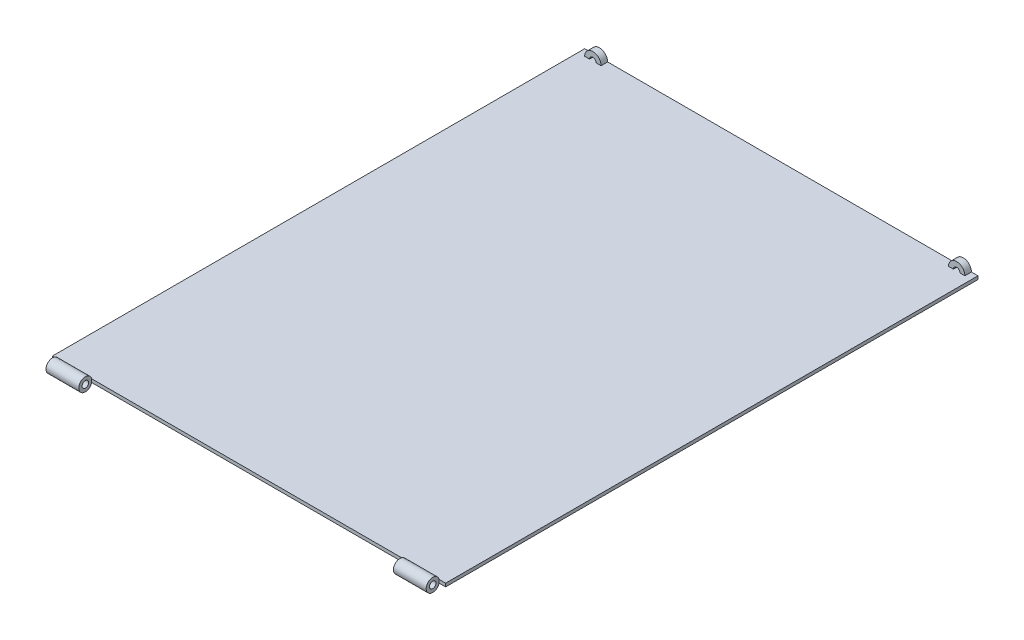
from build123d import *
from build123d.topology import SkipClean

# Parameters (mm, degrees)
SKETCH1_W                       = 60
SKETCH1_H                       = 82.18
BOSS_EXTRUDE1_DEPTH             = 0.5
BOSS_EXTRUDE2_REACH             = 52.879
SKETCH3_R                       = 1
SKETCH3_R_2                     = 0.5
BOSS_EXTRUDE2_DIRECTION_2_REACH = 52.879
SKETCH4_R                       = 0.5
CUT_EXTRUDE1_DEPTH              = 74.301641182
CUT_EXTRUDE2_DEPTH              = 52.702326834
CUT_EXTRUDE2_DEPTH_BACK         = 52.702326834
SKETCH5_W                       = 48
SKETCH5_H                       = 1.968245837
SKETCH5_W_2                     = 1
BOSS_EXTRUDE3_DEPTH             = 1


with BuildPart() as part:
    # Sketch1 → Boss-Extrude1 (new body)
    with BuildSketch(Plane(origin=(0, 0, 0), x_dir=(1, 0, 0), z_dir=(0, 1, 0))):
        Rectangle(SKETCH1_W, SKETCH1_H)
    extrude(amount=BOSS_EXTRUDE1_DEPTH)

    # Boss-Extrude2: up to this face of the body (flat: up to its plane)
    boss_extrude2_end = Plane(part.part.faces().sort_by_distance((30, 0.25, 0))[0])
    # Sketch3 → Boss-Extrude2 (add, up to the picked face)
    with BuildSketch(Plane(origin=(0, 0, 0), x_dir=(0, 0, -1), z_dir=(1, 0, 0)), mode=Mode.PRIVATE) as boss_extrude2_sk1:
        with Locations((-41.09, 0.25)):
            Circle(SKETCH3_R)
        with Locations((-41.09, 0.25)):
            Circle(SKETCH3_R_2, mode=Mode.SUBTRACT)
    boss_extrude2_tool1 = split(extrude(boss_extrude2_sk1.sketch, amount=BOSS_EXTRUDE2_REACH, mode=Mode.PRIVATE), bisect_by=boss_extrude2_end, keep=Keep.BOTH, mode=Mode.PRIVATE)
    add(boss_extrude2_tool1.solids().sort_by(Axis((0, 0.25, 42.061716), (1, 0, 0)))[0])

    # Boss-Extrude2 direction 2: up to this face of the body (flat: up to its plane)
    boss_extrude2_direction_2_end = Plane(part.part.faces().sort_by_distance((-30, 0.25, 0))[0])
    # Sketch3 → Boss-Extrude2 direction 2 (add, up to the picked face)
    with BuildSketch(Plane(origin=(0, 0, 0), x_dir=(0, 0, -1), z_dir=(1, 0, 0)), mode=Mode.PRIVATE) as boss_extrude2_direction_2_sk1:
        with Locations((-41.09, 0.25)):
            Circle(SKETCH3_R)
        with Locations((-41.09, 0.25)):
            Circle(SKETCH3_R_2, mode=Mode.SUBTRACT)
    boss_extrude2_direction_2_tool1 = split(extrude(boss_extrude2_direction_2_sk1.sketch, amount=-BOSS_EXTRUDE2_DIRECTION_2_REACH, mode=Mode.PRIVATE), bisect_by=boss_extrude2_direction_2_end, keep=Keep.BOTH, mode=Mode.PRIVATE)
    add(boss_extrude2_direction_2_tool1.solids().sort_by(Axis((0, 0.25, 42.061716), (-1, 0, 0)))[0])

    # Sketch4 → Cut-Extrude1 (cut, through all)
    with SkipClean():  # the faces are left unmerged after this step: merging them gives an invalid solid
        with BuildSketch(Plane.ZY.offset(30)):
            with Locations((41.09, 0.25)):
                Circle(SKETCH4_R)
        extrude(amount=-CUT_EXTRUDE1_DEPTH, mode=Mode.SUBTRACT)

    # Sketch5 → Cut-Extrude2 (cut, two sides: drawn at the far end of the back side and taken through both)
    with SkipClean():  # the faces are left unmerged after this step: merging them gives an invalid solid
        with BuildSketch(Plane(origin=(0, 0.5, 0), x_dir=(1, 0, 0), z_dir=(0, 1, 0)).offset(-CUT_EXTRUDE2_DEPTH_BACK)):
            with Locations((0, -41.105877082)):
                Rectangle(SKETCH5_W, SKETCH5_H)
            with Locations((-29.5, -41.105877082)):
                Rectangle(SKETCH5_W_2, SKETCH5_H)
            with Locations((29.5, -41.105877082)):
                Rectangle(SKETCH5_W_2, SKETCH5_H)
        extrude(amount=CUT_EXTRUDE2_DEPTH + CUT_EXTRUDE2_DEPTH_BACK, mode=Mode.SUBTRACT)

    # Sketch7 → Boss-Extrude3 (add)
    with SkipClean():  # the faces are left unmerged after this step: merging them gives an invalid solid
        with BuildSketch(Plane(origin=(0, 0, -41.09), x_dir=(-1, 0, 0), z_dir=(0, 0, -1))):
            with BuildLine():
                Line((-29, 0.5), (-28.25, 0.5))
                ThreePointArc((-28.25, 0.5), (-27.75, 1), (-27.25, 0.5))
                Line((-27.25, 0.5), (-26.5, 0.5))
                ThreePointArc((-26.5, 0.5), (-27.75, 1.75), (-29, 0.5))
            make_face()
        boss_extrude3 = extrude(amount=-BOSS_EXTRUDE3_DEPTH)

    # Mirror1: Boss-Extrude3 across plane
    with SkipClean():  # the faces are left unmerged after this step: merging them gives an invalid solid
        add(boss_extrude3.mirror(Plane(origin=(0, 0, 0), x_dir=(0, 0, 1), z_dir=(1, 0, 0))))


solid = part.part
